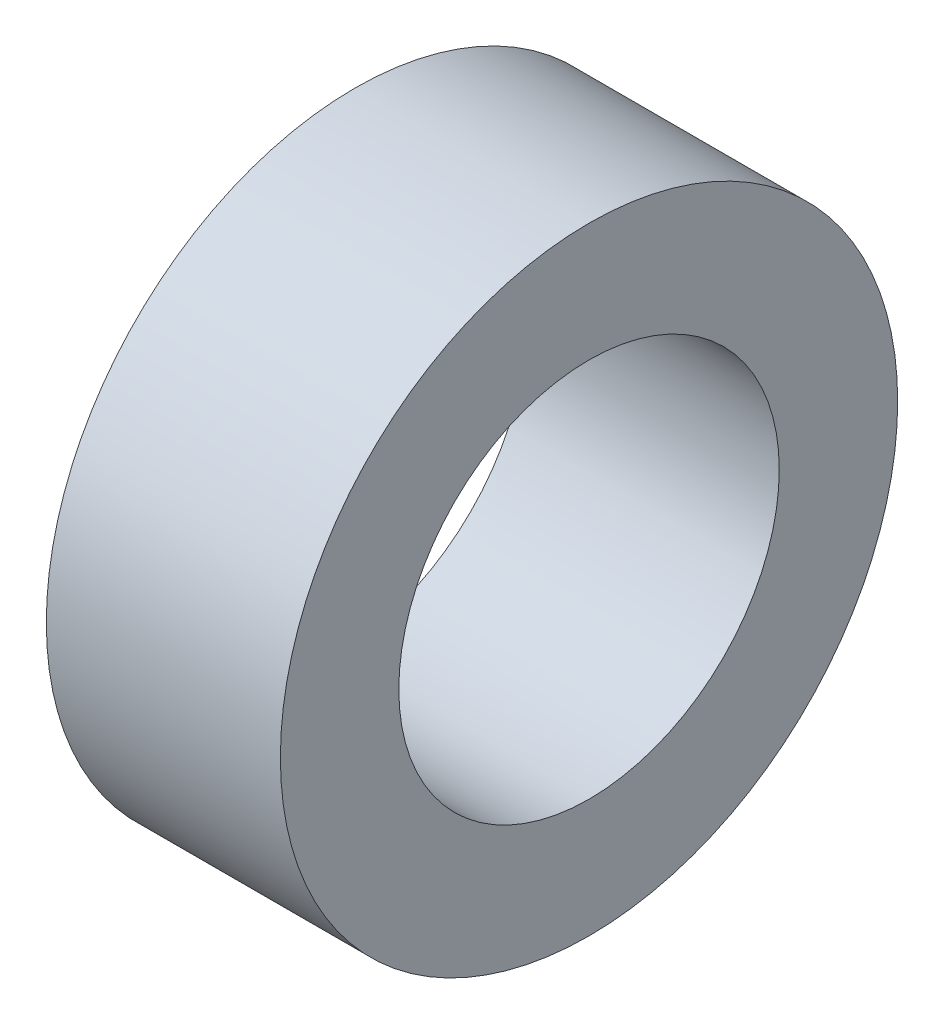
from build123d import *

# Parameters (mm, degrees)
SKETCH1_R           = 11.901099896
SKETCH1_R_2         = 10.2
BOSS_EXTRUDE1_DEPTH = 1.000000032
SKETCH2_R           = 16.55
SKETCH2_R_2         = 10.2
BOSS_EXTRUDE2_DEPTH = 12.550000046


with BuildPart() as part:
    # Sketch1 → Boss-Extrude1 (new body)
    with BuildSketch(Plane(origin=(0, 0, 0), x_dir=(0, 0, -1), z_dir=(1, 0, 0))):
        Circle(SKETCH1_R)
        Circle(SKETCH1_R_2, mode=Mode.SUBTRACT)
    extrude(amount=BOSS_EXTRUDE1_DEPTH)

    # Sketch2 → Boss-Extrude2 (add)
    with BuildSketch(Plane(origin=(1.000000032, 0, 0), x_dir=(0, 0, -1), z_dir=(1, 0, 0))):
        Circle(SKETCH2_R)
        Circle(SKETCH2_R_2, mode=Mode.SUBTRACT)
    extrude(amount=BOSS_EXTRUDE2_DEPTH)


solid = part.part
